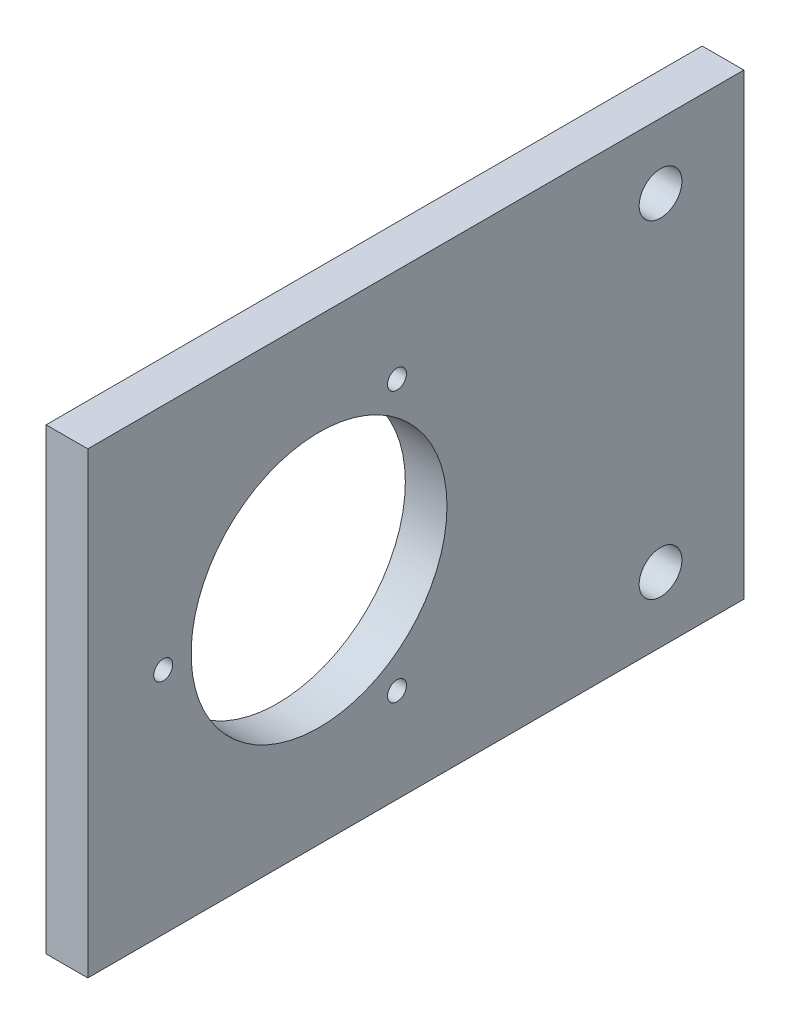
from build123d import *

# Parameters (mm, degrees)
SKETCH1_W           = 69.85
SKETCH1_H           = 100
SKETCH1_R           = 19.5
SKETCH1_R_2         = 3.25755
SKETCH1_R_3         = 1.45
BOSS_EXTRUDE1_DEPTH = 6.35


with BuildPart() as part:
    # Sketch1 → Boss-Extrude1 (new body)
    with BuildSketch(Plane.YZ):
        Rectangle(SKETCH1_W, SKETCH1_H)
        with Locations((0, 14.75)):
            Circle(SKETCH1_R, mode=Mode.SUBTRACT)
        with Locations((-25, -37.3)):
            Circle(SKETCH1_R_2, mode=Mode.SUBTRACT)
        with Locations((25, -37.3)):
            Circle(SKETCH1_R_2, mode=Mode.SUBTRACT)
        with Locations((0, 38.5)):
            Circle(SKETCH1_R_3, mode=Mode.SUBTRACT)
        with Locations((20.56810334, 2.875)):
            Circle(SKETCH1_R_3, mode=Mode.SUBTRACT)
        with Locations((-20.56810334, 2.875)):
            Circle(SKETCH1_R_3, mode=Mode.SUBTRACT)
    extrude(amount=BOSS_EXTRUDE1_DEPTH)


solid = part.part
